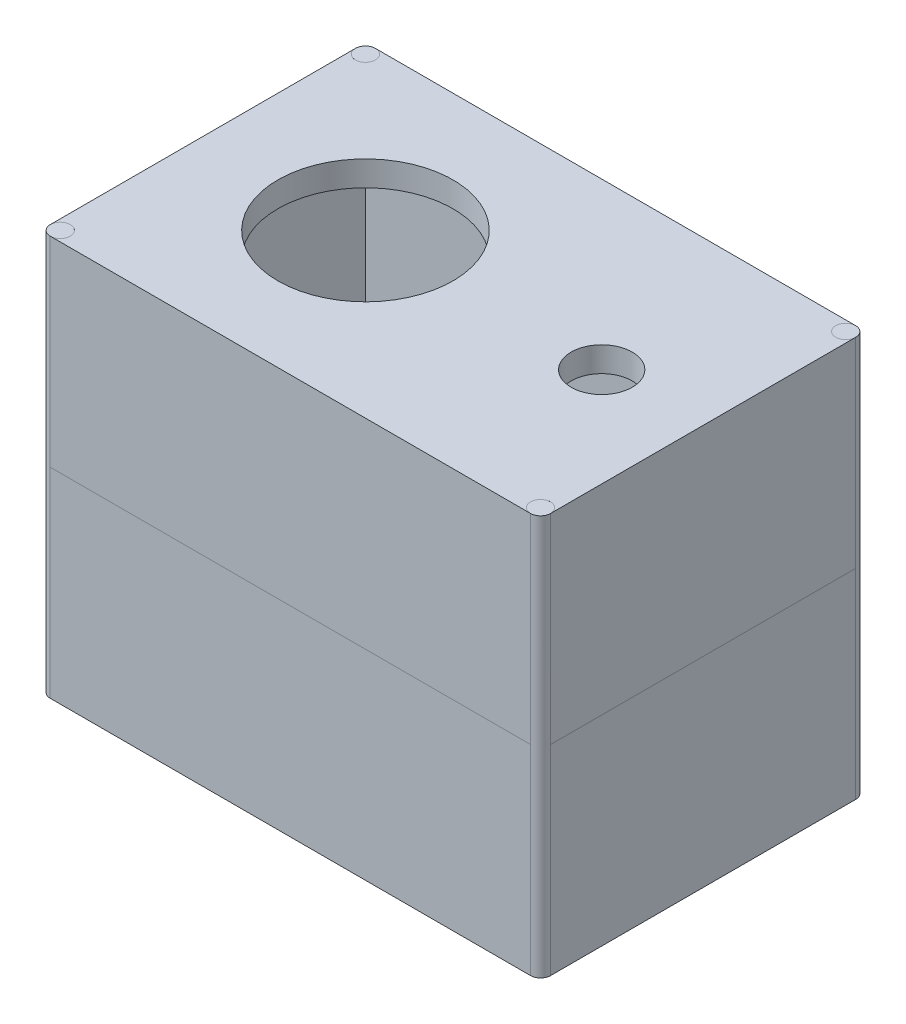
from build123d import *

# Parameters (mm, degrees)
SKETCH1_W             = 100
SKETCH1_H             = 65
BOSS_EXTRUDE1_DEPTH   = 80
SKETCH2_W             = 90
SKETCH2_H             = 55
CUT_EXTRUDE2_DEPTH    = 75
SKETCH4_W             = 90
SKETCH4_H             = 55
BOSS_EXTRUDE2_DEPTH   = 5
SKETCH3_R             = 17.5
CUT_EXTRUDE3_DEPTH    = 5
SKETCH5_R             = 6.10322586
CUT_EXTRUDE4_DEPTH    = 5
SPLIT1_START          = -1
SPLIT1_DEPTH          = 82
SPLIT1_2_OUTLINE_R    = 2
SPLIT1_2_DEPTH        = 80
SPLIT1_3_OUTLINE_R    = 2
SPLIT1_3_DEPTH        = 80
SPLIT1_4_OUTLINE_R    = 2
SPLIT1_4_DEPTH        = 80
SPLIT1_5_OUTLINE_R    = 2
SPLIT1_5_DEPTH        = 80
SPLIT1_6_DEPTH        = 80
SPLIT1_7_DEPTH        = 80
SPLIT1_8_DEPTH        = 80
SPLIT1_9_DEPTH        = 80
SPLIT2_START          = 40
SPLIT2_OUTLINE_W      = 90
SPLIT2_OUTLINE_H      = 55
SPLIT2_DEPTH          = 40
SPLIT2_START_2        = 75
SPLIT2_2_OUTLINE_W    = 90
SPLIT2_2_OUTLINE_H    = 55
SPLIT2_2_OUTLINE_R    = 6.10322586
SPLIT2_2_OUTLINE_R_2  = 17.5
SPLIT2_2_DEPTH        = 5
SPLIT2_3_OUTLINE_R    = 2
SPLIT2_3_DEPTH        = 40
SPLIT2_4_OUTLINE_R    = 2
SPLIT2_4_DEPTH        = 40
SPLIT2_5_OUTLINE_R    = 2
SPLIT2_5_DEPTH        = 40
SPLIT2_6_OUTLINE_R    = 2
SPLIT2_6_DEPTH        = 40
SPLIT2_7_OUTLINE_R    = 2
SPLIT2_7_DEPTH        = 40
SPLIT2_8_OUTLINE_R    = 2
SPLIT2_8_DEPTH        = 40
SPLIT2_9_OUTLINE_R    = 2
SPLIT2_9_DEPTH        = 40
SPLIT2_10_OUTLINE_R   = 2
SPLIT2_10_DEPTH       = 40
SPLIT2_11_OUTLINE_R   = 6.10322586
SPLIT2_11_OUTLINE_R_2 = 17.5
SPLIT2_11_DEPTH       = 40


with BuildPart() as part:
    # Sketch1 → Boss-Extrude1 (new body)
    with BuildSketch(Plane(origin=(0, 0, 0), x_dir=(1, 0, 0), z_dir=(0, 1, 0))):
        with Locations((5.93220339, 0.500770416)):
            Rectangle(SKETCH1_W, SKETCH1_H)
    extrude(amount=BOSS_EXTRUDE1_DEPTH)

    # Sketch2 → Cut-Extrude2 (cut)
    with BuildSketch(Plane(origin=(0, 80, 0), x_dir=(1, 0, 0), z_dir=(0, 1, 0))):
        with Locations((5.93220339, 0.500770416)):
            Rectangle(SKETCH2_W, SKETCH2_H)
    extrude(amount=-CUT_EXTRUDE2_DEPTH, mode=Mode.SUBTRACT)

    # Sketch4 → Boss-Extrude2 (add)
    with BuildSketch(Plane(origin=(0, 80, 0), x_dir=(1, 0, 0), z_dir=(0, 1, 0))):
        with Locations((5.93220339, 0.500770416)):
            Rectangle(SKETCH4_W, SKETCH4_H)
    extrude(amount=-BOSS_EXTRUDE2_DEPTH)

    # Sketch3 → Cut-Extrude3 (cut)
    with BuildSketch(Plane(origin=(0, 80, 0), x_dir=(1, 0, 0), z_dir=(0, 1, 0))):
        with Locations(Location((-11.56779661, 0.500770416, 0), (0, 0, 270))):
            Circle(SKETCH3_R)
    extrude(amount=-CUT_EXTRUDE3_DEPTH, mode=Mode.SUBTRACT)

    # Sketch5 → Cut-Extrude4 (cut)
    with BuildSketch(Plane(origin=(0, 80, 0), x_dir=(1, 0, 0), z_dir=(0, 1, 0))):
        with Locations(Location((36.155377847, 0, 0), (0, 0, 270))):
            Circle(SKETCH5_R)
    extrude(amount=-CUT_EXTRUDE4_DEPTH, mode=Mode.SUBTRACT)

    # Split1: read off the stored shape, not the designer's step
    # Split1 outline → Split1 (cut)
    with BuildSketch(Plane(origin=(0, 0, 0), x_dir=(1, 0, 0), z_dir=(0, 1, 0)).offset(SPLIT1_START)):
        with BuildLine():
            Line((-44.06779661, 33.000770416), (-44.06779661, 31.000770416))
            ThreePointArc((-44.06779661, 31.000770416), (-40.653583048, 29.586556854), (-42.06779661, 33.000770416))
            Line((-42.06779661, 33.000770416), (-44.06779661, 33.000770416))
        make_face()
        with BuildLine():
            ThreePointArc((-42.06779661, -31.999229584), (-40.653583048, -28.585016022), (-44.06779661, -29.999229584))
            Line((-44.06779661, -29.999229584), (-44.06779661, -31.999229584))
            Line((-44.06779661, -31.999229584), (-42.06779661, -31.999229584))
        make_face()
        with BuildLine():
            Line((55.93220339, 33.000770416), (53.93220339, 33.000770416))
            ThreePointArc((53.93220339, 33.000770416), (52.517989827, 29.586556854), (55.93220339, 31.000770416))
            Line((55.93220339, 31.000770416), (55.93220339, 33.000770416))
        make_face()
        with BuildLine():
            ThreePointArc((55.93220339, -29.999229584), (52.517989827, -28.585016021), (53.93220339, -31.999229584))
            Line((53.93220339, -31.999229584), (55.93220339, -31.999229584))
            Line((55.93220339, -31.999229584), (55.93220339, -29.999229584))
        make_face()
    extrude(amount=SPLIT1_DEPTH, mode=Mode.SUBTRACT)

    # Split2 11 outline → Split2 11 (cut)
    with BuildSketch(Plane(origin=(0, 0, 0), x_dir=(1, 0, 0), z_dir=(0, 1, 0)).offset(SPLIT2_START)):
        with BuildLine():
            ThreePointArc((-42.06779661, 33.000770416), (-40.653583048, 29.586556854), (-44.06779661, 31.000770416))
            Line((-44.06779661, 31.000770416), (-44.06779661, -29.999229584))
            ThreePointArc((-44.06779661, -29.999229584), (-40.653583048, -28.585016022), (-42.06779661, -31.999229584))
            Line((-42.06779661, -31.999229584), (53.93220339, -31.999229584))
            ThreePointArc((53.93220339, -31.999229584), (52.517989827, -28.585016021), (55.93220339, -29.999229584))
            Line((55.93220339, -29.999229584), (55.93220339, 31.000770416))
            ThreePointArc((55.93220339, 31.000770416), (52.517989827, 29.586556854), (53.93220339, 33.000770416))
            Line((53.93220339, 33.000770416), (-42.06779661, 33.000770416))
        make_face()
        with Locations((36.155377847, 0)):
            Circle(SPLIT2_11_OUTLINE_R, mode=Mode.SUBTRACT)
        with Locations((-11.56779661, 0.500770416)):
            Circle(SPLIT2_11_OUTLINE_R_2, mode=Mode.SUBTRACT)
    extrude(amount=SPLIT2_11_DEPTH, mode=Mode.SUBTRACT)


with BuildPart() as body_2:
    # Split1 2 outline → Split1 2 (new body)
    with BuildSketch(Plane(origin=(0, 0, 0), x_dir=(1, 0, 0), z_dir=(0, 1, 0))):
        with Locations((53.93220339, 31.000770416)):
            Circle(SPLIT1_2_OUTLINE_R)
    extrude(amount=SPLIT1_2_DEPTH)

    # Split2 9 outline → Split2 9 (cut)
    with BuildSketch(Plane(origin=(0, 0, 0), x_dir=(1, 0, 0), z_dir=(0, 1, 0))):
        with Locations((53.93220339, 31.000770416)):
            Circle(SPLIT2_9_OUTLINE_R)
    extrude(amount=SPLIT2_9_DEPTH, mode=Mode.SUBTRACT)


with BuildPart() as body_3:
    # Split1 3 outline → Split1 3 (new body)
    with BuildSketch(Plane(origin=(0, 0, 0), x_dir=(1, 0, 0), z_dir=(0, 1, 0))):
        with Locations((-42.06779661, -29.999229584)):
            Circle(SPLIT1_3_OUTLINE_R)
    extrude(amount=SPLIT1_3_DEPTH)

    # Split2 3 outline → Split2 3 (cut)
    with BuildSketch(Plane(origin=(0, 0, 0), x_dir=(1, 0, 0), z_dir=(0, 1, 0)).offset(SPLIT2_START)):
        with Locations((-42.06779661, -29.999229584)):
            Circle(SPLIT2_3_OUTLINE_R)
    extrude(amount=SPLIT2_3_DEPTH, mode=Mode.SUBTRACT)


with BuildPart() as body_4:
    # Split1 4 outline → Split1 4 (new body)
    with BuildSketch(Plane(origin=(0, 0, 0), x_dir=(1, 0, 0), z_dir=(0, 1, 0))):
        with Locations((53.93220339, -29.999229584)):
            Circle(SPLIT1_4_OUTLINE_R)
    extrude(amount=SPLIT1_4_DEPTH)

    # Split2 6 outline → Split2 6 (cut)
    with BuildSketch(Plane(origin=(0, 0, 0), x_dir=(1, 0, 0), z_dir=(0, 1, 0))):
        with Locations((53.93220339, -29.999229584)):
            Circle(SPLIT2_6_OUTLINE_R)
    extrude(amount=SPLIT2_6_DEPTH, mode=Mode.SUBTRACT)


with BuildPart() as body_5:
    # Split1 5 outline → Split1 5 (new body)
    with BuildSketch(Plane(origin=(0, 0, 0), x_dir=(1, 0, 0), z_dir=(0, 1, 0))):
        with Locations((-42.06779661, 31.000770416)):
            Circle(SPLIT1_5_OUTLINE_R)
    extrude(amount=SPLIT1_5_DEPTH)

    # Split2 4 outline → Split2 4 (cut)
    with BuildSketch(Plane(origin=(0, 0, 0), x_dir=(1, 0, 0), z_dir=(0, 1, 0))):
        with Locations((-42.06779661, 31.000770416)):
            Circle(SPLIT2_4_OUTLINE_R)
    extrude(amount=SPLIT2_4_DEPTH, mode=Mode.SUBTRACT)


with BuildPart() as body_6:
    # Split1 6 outline → Split1 6 (new body)
    with BuildSketch(Plane(origin=(0, 0, 0), x_dir=(1, 0, 0), z_dir=(0, 1, 0))):
        with BuildLine():
            ThreePointArc((-42.06779661, -31.999229584), (-43.482010173, -31.413443146), (-44.06779661, -29.999229584))
            Line((-44.06779661, -29.999229584), (-44.06779661, -31.999229584))
            Line((-44.06779661, -31.999229584), (-42.06779661, -31.999229584))
        make_face()
    extrude(amount=SPLIT1_6_DEPTH)


with BuildPart() as body_7:
    # Split1 7 outline → Split1 7 (new body)
    with BuildSketch(Plane(origin=(0, 0, 0), x_dir=(1, 0, 0), z_dir=(0, 1, 0))):
        with BuildLine():
            ThreePointArc((-44.06779661, 31.000770416), (-43.482010173, 32.414983978), (-42.06779661, 33.000770416))
            Line((-42.06779661, 33.000770416), (-44.06779661, 33.000770416))
            Line((-44.06779661, 33.000770416), (-44.06779661, 31.000770416))
        make_face()
    extrude(amount=SPLIT1_7_DEPTH)


with BuildPart() as body_8:
    # Split1 8 outline → Split1 8 (new body)
    with BuildSketch(Plane(origin=(0, 0, 0), x_dir=(1, 0, 0), z_dir=(0, 1, 0))):
        with BuildLine():
            ThreePointArc((55.93220339, -29.999229584), (55.346416952, -31.413443146), (53.93220339, -31.999229584))
            Line((53.93220339, -31.999229584), (55.93220339, -31.999229584))
            Line((55.93220339, -31.999229584), (55.93220339, -29.999229584))
        make_face()
    extrude(amount=SPLIT1_8_DEPTH)


with BuildPart() as body_9:
    # Split1 9 outline → Split1 9 (new body)
    with BuildSketch(Plane(origin=(0, 0, 0), x_dir=(1, 0, 0), z_dir=(0, 1, 0))):
        with BuildLine():
            ThreePointArc((53.93220339, 33.000770416), (55.346416952, 32.414983978), (55.93220339, 31.000770416))
            Line((55.93220339, 31.000770416), (55.93220339, 33.000770416))
            Line((55.93220339, 33.000770416), (53.93220339, 33.000770416))
        make_face()
    extrude(amount=SPLIT1_9_DEPTH)


with BuildPart() as body_6_2:
    # Split2: read off the stored shape, not the designer's step
    # Split2 outline → Split2 (new body)
    with BuildSketch(Plane(origin=(0, 0, 0), x_dir=(1, 0, 0), z_dir=(0, 1, 0)).offset(SPLIT2_START)):
        with BuildLine():
            Line((55.93220339, -29.999229584), (55.93220339, 31.000770416))
            ThreePointArc((55.93220339, 31.000770416), (52.517989827, 29.586556854), (53.93220339, 33.000770416))
            Line((53.93220339, 33.000770416), (-42.06779661, 33.000770416))
            ThreePointArc((-42.06779661, 33.000770416), (-40.653583048, 29.586556854), (-44.06779661, 31.000770416))
            Line((-44.06779661, 31.000770416), (-44.06779661, -29.999229584))
            ThreePointArc((-44.06779661, -29.999229584), (-40.653583048, -28.585016022), (-42.06779661, -31.999229584))
            Line((-42.06779661, -31.999229584), (53.93220339, -31.999229584))
            ThreePointArc((53.93220339, -31.999229584), (52.517989827, -28.585016021), (55.93220339, -29.999229584))
        make_face()
        with Locations((5.93220339, 0.500770416)):
            Rectangle(SPLIT2_OUTLINE_W, SPLIT2_OUTLINE_H, mode=Mode.SUBTRACT)
    extrude(amount=SPLIT2_DEPTH)

    # Split2 2 outline → Split2 2 (add)
    with BuildSketch(Plane(origin=(0, 0, 0), x_dir=(1, 0, 0), z_dir=(0, 1, 0)).offset(SPLIT2_START_2)):
        with Locations((5.93220339, 0.500770416)):
            Rectangle(SPLIT2_2_OUTLINE_W, SPLIT2_2_OUTLINE_H)
        with Locations((36.155377847, 0)):
            Circle(SPLIT2_2_OUTLINE_R, mode=Mode.SUBTRACT)
        with Locations((-11.56779661, 0.500770416)):
            Circle(SPLIT2_2_OUTLINE_R_2, mode=Mode.SUBTRACT)
    extrude(amount=SPLIT2_2_DEPTH)


with BuildPart() as body_7_2:
    # Split2 5 outline → Split2 5 (new body)
    with BuildSketch(Plane(origin=(0, 0, 0), x_dir=(1, 0, 0), z_dir=(0, 1, 0))):
        with Locations((-42.06779661, 31.000770416)):
            Circle(SPLIT2_5_OUTLINE_R)
    extrude(amount=SPLIT2_5_DEPTH)


with BuildPart() as body_8_2:
    # Split2 7 outline → Split2 7 (new body)
    with BuildSketch(Plane(origin=(0, 0, 0), x_dir=(1, 0, 0), z_dir=(0, 1, 0)).offset(SPLIT2_START)):
        with Locations((-42.06779661, -29.999229584)):
            Circle(SPLIT2_7_OUTLINE_R)
    extrude(amount=SPLIT2_7_DEPTH)


with BuildPart() as body_9_2:
    # Split2 8 outline → Split2 8 (new body)
    with BuildSketch(Plane(origin=(0, 0, 0), x_dir=(1, 0, 0), z_dir=(0, 1, 0))):
        with Locations((53.93220339, -29.999229584)):
            Circle(SPLIT2_8_OUTLINE_R)
    extrude(amount=SPLIT2_8_DEPTH)


with BuildPart() as body_10:
    # Split2 10 outline → Split2 10 (new body)
    with BuildSketch(Plane(origin=(0, 0, 0), x_dir=(1, 0, 0), z_dir=(0, 1, 0))):
        with Locations((53.93220339, 31.000770416)):
            Circle(SPLIT2_10_OUTLINE_R)
    extrude(amount=SPLIT2_10_DEPTH)


with BuildPart() as part_1:
    add(part.part)

    # Combine1: read off the stored shape, not the designer's step
    # Combine1: union body 3, body 5, body 7 2, body 4, body 8 2, body 9 2, body 2, body 10
    add(body_3.part)
    add(body_5.part)
    add(body_7_2.part)
    add(body_4.part)
    add(body_8_2.part)
    add(body_9_2.part)
    add(body_2.part)
    add(body_10.part)


solid = Compound([body_6_2.part, part_1.part])
